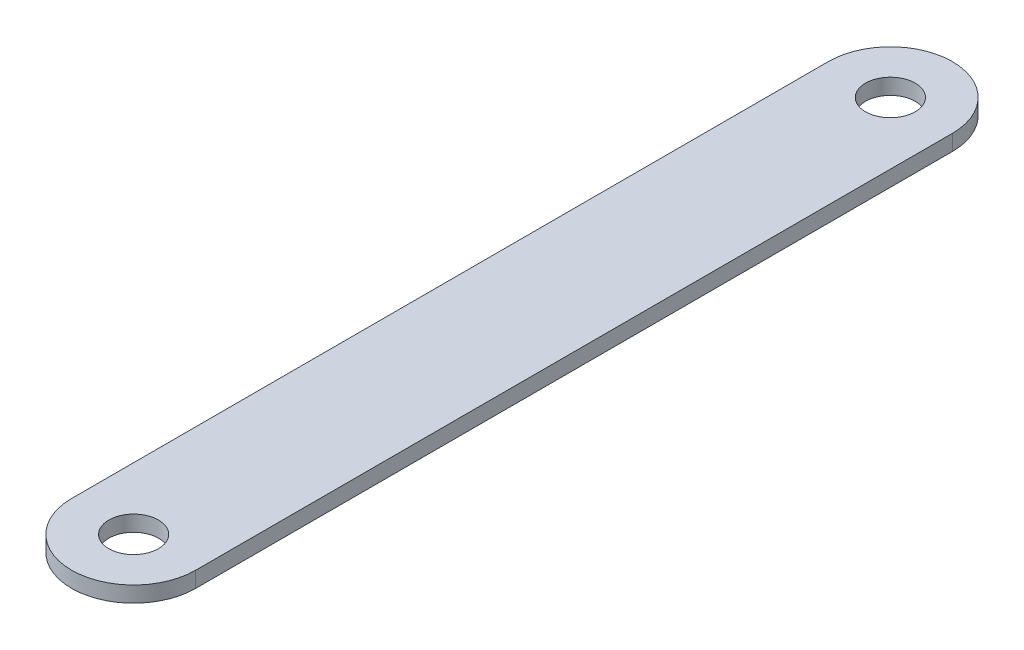
from build123d import *

# Parameters (mm, degrees)
SKETCH2_R           = 2
BOSS_EXTRUDE1_DEPTH = 1.27


with BuildPart() as part:
    # Sketch2 → Boss-Extrude1 (new body)
    with BuildSketch(Plane(origin=(0, 0, 0), x_dir=(1, 0, 0), z_dir=(0, 1, 0))):
        with BuildLine():
            Line((-5, 60.946920772), (-5, 0))
            ThreePointArc((-5, 0), (0, -5), (5, 0))
            Line((5, 0), (5, 60.946920772))
            ThreePointArc((5, 60.946920772), (0, 65.946920772), (-5, 60.946920772))
        make_face()
        Circle(SKETCH2_R, mode=Mode.SUBTRACT)
        with Locations((0, 60.946920772)):
            Circle(SKETCH2_R, mode=Mode.SUBTRACT)
    extrude(amount=BOSS_EXTRUDE1_DEPTH)


solid = part.part
